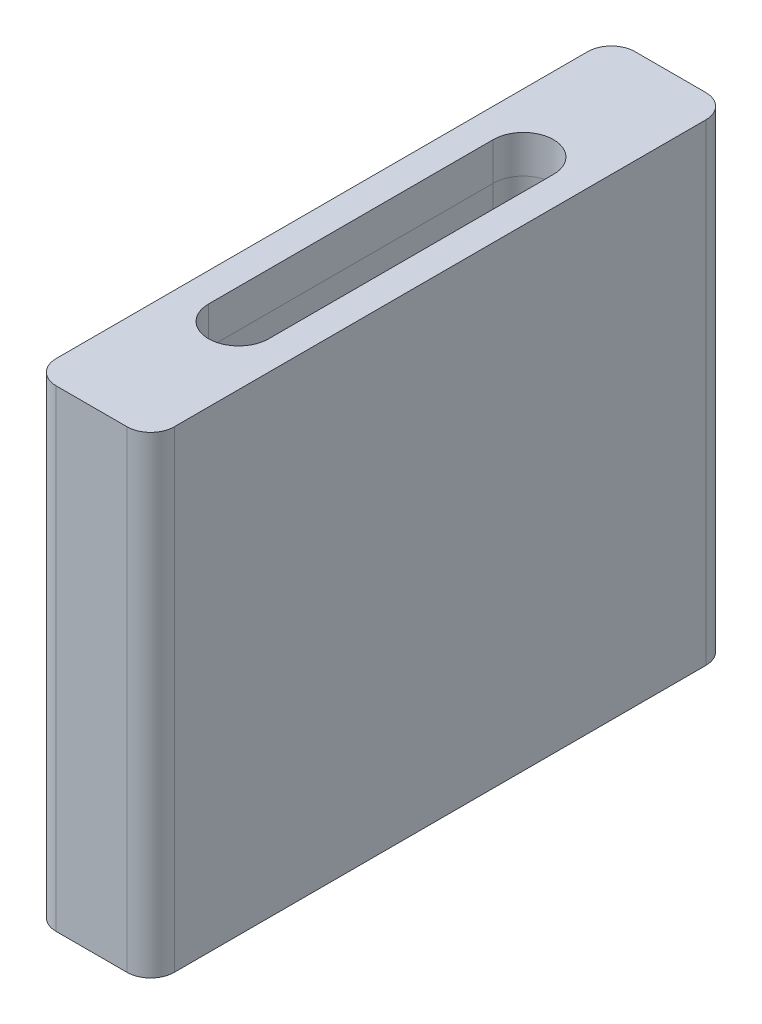
from build123d import *

# Parameters (mm, degrees)
BOSS_EXTRUDE1_DEPTH         = 40
CUT_EXTRUDE2_REACH          = 49.173
M6_TAPPED_HOLE1_D           = 5
M6_TAPPED_HOLE1_DEPTH       = 17
M6_TAPPED_HOLE1_CSINK_D     = 6.05
M6_TAPPED_HOLE1_CSINK_ANGLE = 90
M6_TAPPED_HOLE1_TIP         = 1.502151548


with BuildPart() as part:
    # Sketch1 → Boss-Extrude1 (new body)
    with BuildSketch(Plane(origin=(0, 0, 0), x_dir=(1, 0, 0), z_dir=(0, 1, 0))):
        with BuildLine():
            Line((-3, -24.5), (3, -24.5))
            ThreePointArc((3, -24.5), (4.414213562, -23.914213562), (5, -22.5))
            Line((5, -22.5), (5, 22.5))
            ThreePointArc((5, 22.5), (4.414213562, 23.914213562), (3, 24.5))
            Line((3, 24.5), (-3, 24.5))
            ThreePointArc((-3, 24.5), (-4.414213562, 23.914213562), (-5, 22.5))
            Line((-5, 22.5), (-5, -22.5))
            ThreePointArc((-5, -22.5), (-4.414213562, -23.914213562), (-3, -24.5))
        make_face()
    extrude(amount=-BOSS_EXTRUDE1_DEPTH)

    # Sketch5 → Cut-Extrude2 (cut, up to next)
    with BuildSketch(Plane(origin=(0, 0, 0), x_dir=(1, 0, 0), z_dir=(0, 1, 0)), mode=Mode.PRIVATE) as cut_extrude2_sk1:
        with BuildLine():
            Line((-2.55, -12.05), (-2.55, 12.05))
            ThreePointArc((-2.55, 12.05), (0, 14.6), (2.55, 12.05))
            Line((2.55, 12.05), (2.55, -12.05))
            ThreePointArc((2.55, -12.05), (0, -14.6), (-2.55, -12.05))
        make_face()
    cut_extrude2_tool1 = extrude(cut_extrude2_sk1.sketch, amount=-CUT_EXTRUDE2_REACH, mode=Mode.PRIVATE) & part.part
    add(cut_extrude2_tool1.solids().sort_by_distance((0, 0, 0))[0], mode=Mode.SUBTRACT)

    # Cut-Sweep1: sweep along a path in Sketch8
    with BuildLine(Plane(origin=(0, 0, 0), x_dir=(1, 0, 0), z_dir=(0, 1, 0))) as cut_sweep1_path:
        Line((-2.55, 12.05), (-2.55, -12.05))
        ThreePointArc((-2.55, -12.05), (0, -14.6), (2.55, -12.05))
        Line((2.55, -12.05), (2.55, 12.05))
        ThreePointArc((2.55, 12.05), (0, 14.6), (-2.55, 12.05))
    # Sketch7 → Cut-Sweep1 (sweep, cut)
    with BuildSketch(Plane.XY):
        Polygon((2.55, -3.2), (3.192346389, -40), (2.55, -40), align=None)
    sweep(path=cut_sweep1_path.line, mode=Mode.SUBTRACT)

    # M6 Tapped Hole1
    with Locations(Plane(origin=(0, -40, 0), x_dir=(-1, 0, 0), z_dir=(0, -1, 0))):
        with Locations((0, 19.5), (0, -19.5)):
            CounterSinkHole(M6_TAPPED_HOLE1_D / 2, M6_TAPPED_HOLE1_CSINK_D / 2, depth=M6_TAPPED_HOLE1_DEPTH, counter_sink_angle=M6_TAPPED_HOLE1_CSINK_ANGLE)
            with Locations((0, 0, -(M6_TAPPED_HOLE1_DEPTH + M6_TAPPED_HOLE1_TIP / 2))):  # 118° drill point
                Cone(0, M6_TAPPED_HOLE1_D / 2, M6_TAPPED_HOLE1_TIP, mode=Mode.SUBTRACT)


solid = part.part
